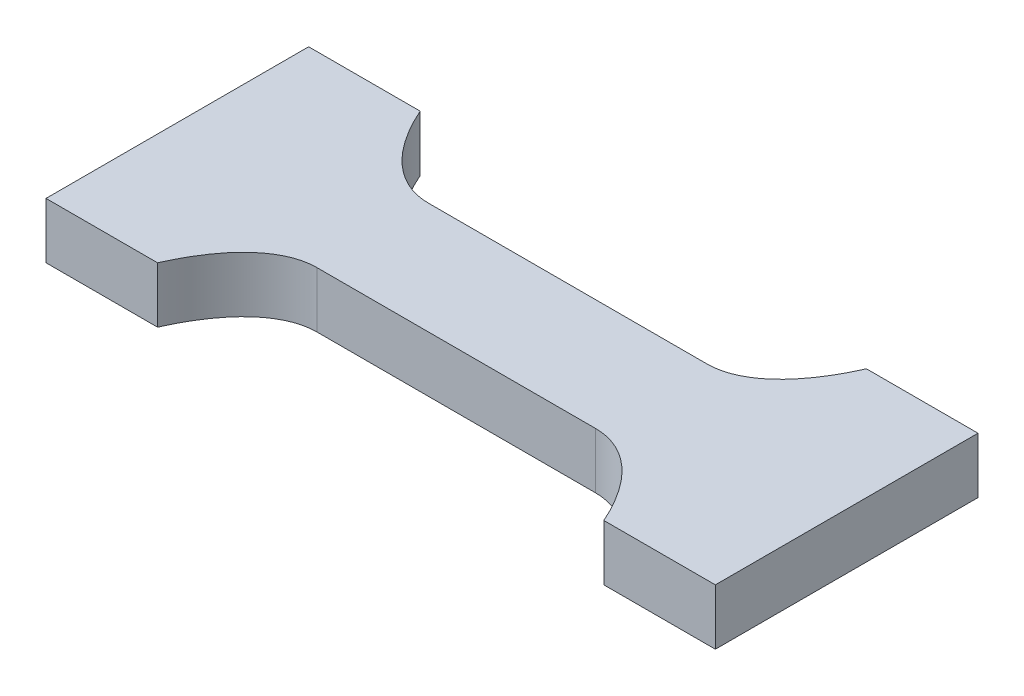
from build123d import *

# Parameters (mm, degrees)
BOSS_EXTRUDE1_DEPTH         = 5
MIRROR1_DEPTH               = 5
SCALE1_SCALE                = 0.6
SCALE2_SCALE_X              = 0.5
SCALE2_SCALE_Y              = 1
SCALE2_SCALE_Z              = 1
SKETCH2_W                   = 9
SKETCH2_H                   = 6
CUT_EXTRUDE1_DEPTH          = 98.801494894
BODY_MOVE_COPY1_START       = 1
BODY_MOVE_COPY1_DEPTH       = 3
BODY_MOVE_COPY1_2_OUTLINE_W = 9
BODY_MOVE_COPY1_2_OUTLINE_H = 6
BODY_MOVE_COPY1_2_DEPTH     = 3


# Read off the part's stored shape, not the designer's step: Mirror1, Body-Move/Copy1
with BuildPart() as part:
    # Sketch1 → Boss-Extrude1 (new body)
    with BuildSketch(Plane(origin=(0, 0, 0), x_dir=(1, 0, 0), z_dir=(0, 1, 0))):
        with BuildLine():
            Line((0, 0), (0, 11.771243445))
            Line((0, 11.771243445), (20, 11.771243445))
            ThreePointArc((20, 11.771243445), (26.771243445, 6.771243445), (35, 5))
            Line((35, 5), (75, 5))
            Line((75, 5), (75, 0))
            Line((75, 0), (0, 0))
        make_face()
    extrude(amount=BOSS_EXTRUDE1_DEPTH)

    # Mirror1 outline → Mirror1 (add)
    with BuildSketch(Plane(origin=(0, 0, 0), x_dir=(1, 0, 0), z_dir=(0, 1, 0))):
        with BuildLine():
            Line((115, 5), (75, 5))
            Line((75, 5), (75, 0))
            Line((75, 0), (0, 0))
            Line((0, 0), (0, -11.771243445))
            Line((0, -11.771243445), (20, -11.771243445))
            ThreePointArc((20, -11.771243445), (26.771243445, -6.771243445), (35, -5))
            Line((35, -5), (115, -5))
            ThreePointArc((115, -5), (123.228756555, -6.771243445), (130, -11.771243445))
            Line((130, -11.771243445), (150, -11.771243445))
            Line((150, -11.771243445), (150, 11.771243445))
            Line((150, 11.771243445), (130, 11.771243445))
            ThreePointArc((130, 11.771243445), (123.228756555, 6.771243445), (115, 5))
        make_face()
    extrude(amount=MIRROR1_DEPTH)


with BuildPart() as part_1:
    # Scale1: scaled about (75, 2.5, 0)
    add(part.part.scale(SCALE1_SCALE).moved(Location((30, 1, 0))))


with BuildPart() as part_2:
    # Scale2: scaled about (75, 2.5, 0)
    add(part_1.part.scale((SCALE2_SCALE_X, SCALE2_SCALE_Y, SCALE2_SCALE_Z), about=(75, 2.5, 0)))

    # Sketch2 → Cut-Extrude1 (cut, through all)
    with BuildSketch(Plane(origin=(0, 4, 0), x_dir=(1, 0, 0), z_dir=(0, 1, 0))):
        with Locations((70.5, 0)):
            Rectangle(SKETCH2_W, SKETCH2_H)
    extrude(amount=-CUT_EXTRUDE1_DEPTH, mode=Mode.SUBTRACT)


with BuildPart() as cut_extrude1_piece_1:
    # of the separate pieces the step leaves, piece 1, a body of its own (cut_extrude1_pieces)
    add(part_2.part.solids().sort_by_distance((75, 1, 3))[0])

    # Body-Move/Copy1 outline → Body-Move/Copy1 (cut)
    with BuildSketch(Plane(origin=(0, 0, 0), x_dir=(1, 0, 0), z_dir=(0, 1, 0)).offset(BODY_MOVE_COPY1_START)):
        with BuildLine():
            add(Edge.make_bspline(
                [(91.5, 7.062746067), (90.655623636, 5.147880462), (89.601040636, 3.949624901), (88.5, 3.381049961)],
                knots=[0.344491118, 0.344491118, 0.344491118, 0.344491118, 0.443649167, 0.443649167, 0.443649167, 0.443649167], degree=3, weights=[0.571428571, 0.621399531, 0.697590007, 0.8]))
            Line((88.5, 3.381049961), (88.5, -3.381049961))
            add(Edge.make_bspline(
                [(88.5, -3.381049961), (89.601040636, -3.949624901), (90.655623636, -5.147880462), (91.5, -7.062746067)],
                knots=[0.056350833, 0.056350833, 0.056350833, 0.056350833, 0.155508882, 0.155508882, 0.155508882, 0.155508882], degree=3, weights=[0.8, 0.697590007, 0.621399531, 0.571428571]))
            Line((91.5, -7.062746067), (97.5, -7.062746067))
            Line((97.5, -7.062746067), (97.5, 7.062746067))
            Line((97.5, 7.062746067), (91.5, 7.062746067))
        make_face()
    extrude(amount=BODY_MOVE_COPY1_DEPTH, mode=Mode.SUBTRACT)

    # Body-Move_Copy1 2 outline → Body-Move_Copy1 2 (add)
    with BuildSketch(Plane(origin=(0, 0, 0), x_dir=(1, 0, 0), z_dir=(0, 1, 0)).offset(BODY_MOVE_COPY1_START)):
        with BuildLine():
            Line((88.5, 7.062746067), (82.5, 7.062746067))
            add(Edge.make_bspline(
                [(82.5, 7.062746067), (81.233643288, 4.190918983), (79.569499126, 3), (78, 3)],
                knots=[0.344491118, 0.344491118, 0.344491118, 0.344491118, 0.5, 0.5, 0.5, 0.5], degree=3, weights=[0.571428571, 0.649797681, 0.792654824, 1]))
            Line((78, 3), (87, 3))
            add(Edge.make_bspline(
                [(88.5, 3.381049961), (87.991386346, 3.118403), (87.487429398, 3), (87, 3)],
                knots=[0.443649167, 0.443649167, 0.443649167, 0.443649167, 0.5, 0.5, 0.5, 0.5], degree=3, weights=[0.8, 0.85819889, 0.924865556, 1]))
            Line((88.5, 3.381049961), (88.5, 7.062746067))
        make_face()
        with Locations((70.5, 0)):
            Rectangle(BODY_MOVE_COPY1_2_OUTLINE_W, BODY_MOVE_COPY1_2_OUTLINE_H)
        with BuildLine():
            Line((88.5, -7.062746067), (88.5, -3.381049961))
            add(Edge.make_bspline(
                [(87, -3), (87.487429398, -3), (87.991386346, -3.118403), (88.5, -3.381049961)],
                knots=[0, 0, 0, 0, 0.056350833, 0.056350833, 0.056350833, 0.056350833], degree=3, weights=[1, 0.924865556, 0.85819889, 0.8]))
            Line((87, -3), (78, -3))
            add(Edge.make_bspline(
                [(78, -3), (79.569499126, -3), (81.233643288, -4.190918983), (82.5, -7.062746067)],
                knots=[0, 0, 0, 0, 0.155508882, 0.155508882, 0.155508882, 0.155508882], degree=3, weights=[1, 0.792654824, 0.649797681, 0.571428571]))
            Line((82.5, -7.062746067), (88.5, -7.062746067))
        make_face()
    extrude(amount=BODY_MOVE_COPY1_2_DEPTH)


with BuildPart() as cut_extrude1_piece_2:
    # of the separate pieces the step leaves, piece 2, a body of its own (cut_extrude1_pieces)
    add(part_2.part.solids().sort_by_distance((52.5, 1, -7.062746067))[0])


with BuildPart() as cut_extrude1_piece_1_1:
    add(cut_extrude1_piece_1.part)

    # Combine1: union Cut-Extrude1 piece 2
    add(cut_extrude1_piece_2.part)


solid = cut_extrude1_piece_1_1.part
